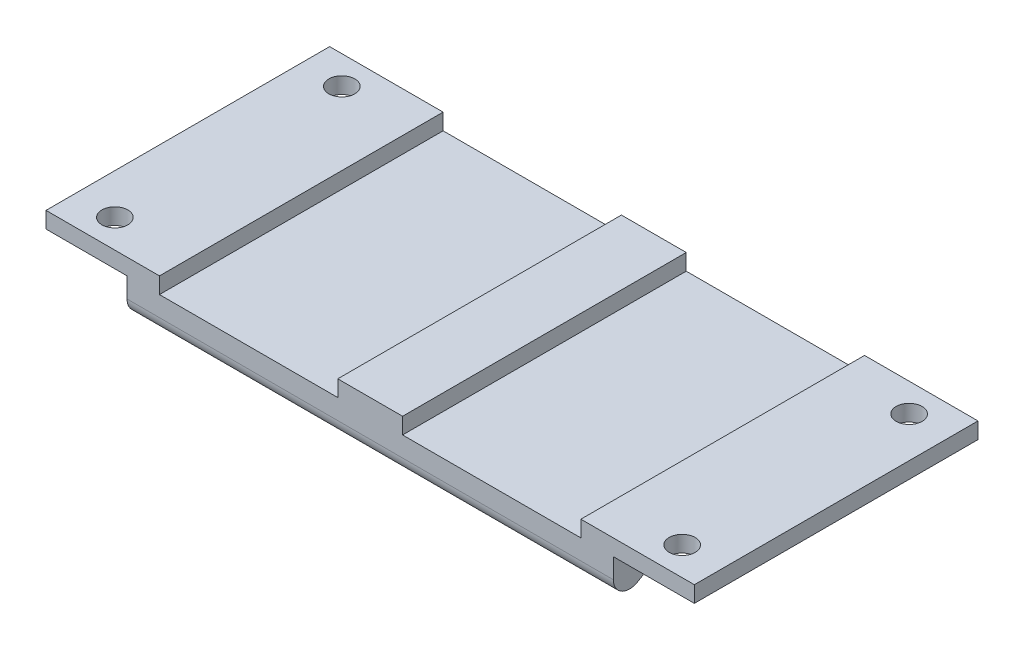
from build123d import *

# Parameters (mm, degrees)
SKETCH1_W               = 60
SKETCH1_H               = 35
BOSS_EXTRUDE1_DEPTH     = 8
CUT_EXTRUDE1_DEPTH      = 64.009919854
CUT_EXTRUDE1_DEPTH_BACK = 64.009919854
FILLET1_R               = 2
SKETCH3_W               = 22
SKETCH3_H               = 2
CUT_EXTRUDE2_DEPTH      = 47.549222321
SKETCH5_W               = 35
SKETCH5_H               = 2
BOSS_EXTRUDE2_DEPTH     = 10
SKETCH6_R               = 1.6
CUT_EXTRUDE3_DEPTH      = 10


with BuildPart() as part:
    # Sketch1 → Boss-Extrude1 (new body)
    with BuildSketch(Plane(origin=(0, 0, 0), x_dir=(1, 0, 0), z_dir=(0, 1, 0))):
        Rectangle(SKETCH1_W, SKETCH1_H)
    extrude(amount=-BOSS_EXTRUDE1_DEPTH)

    # Sketch2 → Cut-Extrude1 (cut, two sides: drawn at the far end of the back side and taken through both)
    with BuildSketch(Plane(origin=(30, 0, 0), x_dir=(0, 0, -1), z_dir=(1, 0, 0)).offset(-CUT_EXTRUDE1_DEPTH_BACK)):
        Polygon((-12.5, -5), (-17.5, -8), (17.5, -8), (12.5, -5), align=None)
    extrude(amount=CUT_EXTRUDE1_DEPTH + CUT_EXTRUDE1_DEPTH_BACK, mode=Mode.SUBTRACT)

    # Fillet1
    fillet1_edges = [part.edges().sort_by_distance(p)[0] for p in [
        (0, -5, 12.5),
        (0, -5, -12.5),
        (0, -8, -17.5),
        (0, -8, 17.5),
    ]]
    fillet(fillet1_edges, radius=FILLET1_R)

    # Sketch3 → Cut-Extrude2 (cut, through all)
    with BuildSketch(Plane.XY.offset(17.5)):
        with Locations((-15, -1)):
            Rectangle(SKETCH3_W, SKETCH3_H)
        with Locations((15, -1)):
            Rectangle(SKETCH3_W, SKETCH3_H)
    extrude(amount=-CUT_EXTRUDE2_DEPTH, mode=Mode.SUBTRACT)

    # Sketch5 → Boss-Extrude2 (add)
    with BuildSketch(Plane.ZY.offset(30)):
        with Locations((0, -1)):
            Rectangle(SKETCH5_W, SKETCH5_H)
    boss_extrude2 = extrude(amount=BOSS_EXTRUDE2_DEPTH)

    # Mirror1: Boss-Extrude2 across plane
    add(boss_extrude2.mirror(Plane(origin=(0, 0, 0), x_dir=(0, 0, 1), z_dir=(1, 0, 0))))

    # Sketch6 → Cut-Extrude3 (cut)
    with BuildSketch(Plane(origin=(0, 0, 0), x_dir=(1, 0, 0), z_dir=(0, 1, 0))):
        with Locations((-35, 14)):
            Circle(SKETCH6_R)
        with Locations((35, 14)):
            Circle(SKETCH6_R)
        with Locations((35, -14)):
            Circle(SKETCH6_R)
        with Locations((-35, -14)):
            Circle(SKETCH6_R)
    extrude(amount=-CUT_EXTRUDE3_DEPTH, mode=Mode.SUBTRACT)


solid = part.part
